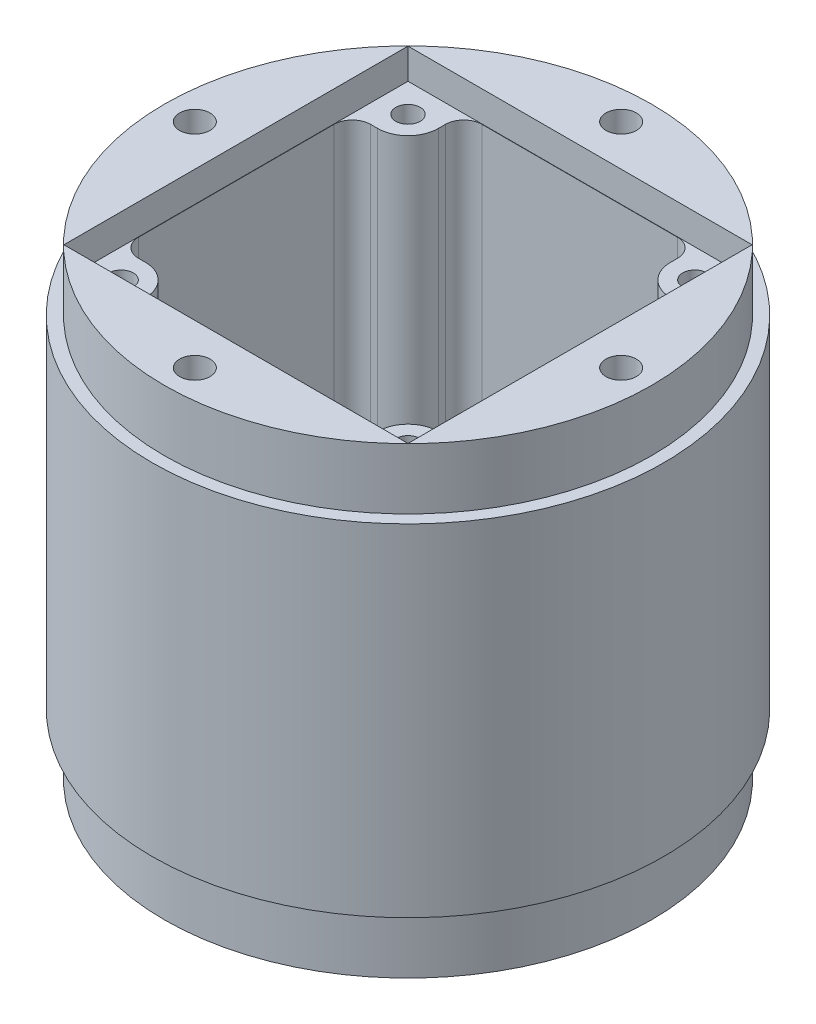
from build123d import *

# Parameters (mm, degrees)
SKETCH2_R           = 40
BOSS_EXTRUDE1_DEPTH = 76
SKETCH3_W           = 8
SKETCH3_H           = 20
CUT_EXTRUDE1_DEPTH  = 3
SKETCH4_R           = 42
SKETCH4_R_2         = 40
BOSS_EXTRUDE3_DEPTH = 28
SKETCH5_W           = 56.5
SKETCH5_H           = 56.5
CUT_EXTRUDE7_DEPTH  = 5
SKETCH6_R           = 2
CUT_EXTRUDE8_DEPTH  = 93.568893263
SKETCH7_R           = 2.5
CUT_EXTRUDE9_DEPTH  = 97.457244414


with BuildPart() as part:
    # Sketch2 → Boss-Extrude1 (new body)
    with BuildSketch(Plane(origin=(0, 0, 0), x_dir=(1, 0, 0), z_dir=(0, 1, 0))):
        Circle(SKETCH2_R)
        with BuildLine():
            Line((-16.05, 28.2), (16.05, 28.2))
            ThreePointArc((16.05, 28.2), (18.171320344, 27.321320344), (19.05, 25.2))
            Line((19.05, 25.2), (19.05, 24.05))
            ThreePointArc((19.05, 24.05), (20.514466094, 20.514466094), (24.05, 19.05))
            Line((24.05, 19.05), (25.2, 19.05))
            ThreePointArc((25.2, 19.05), (27.321320344, 18.171320344), (28.2, 16.05))
            Line((28.2, 16.05), (28.2, -16.05))
            ThreePointArc((28.2, -16.05), (27.321320344, -18.171320344), (25.2, -19.05))
            Line((25.2, -19.05), (24.05, -19.05))
            ThreePointArc((24.05, -19.05), (20.514466094, -20.514466094), (19.05, -24.05))
            Line((19.05, -24.05), (19.05, -25.2))
            ThreePointArc((19.05, -25.2), (18.171320344, -27.321320344), (16.05, -28.2))
            Line((16.05, -28.2), (-16.05, -28.2))
            ThreePointArc((-16.05, -28.2), (-18.171320344, -27.321320344), (-19.05, -25.2))
            Line((-19.05, -25.2), (-19.05, -24.05))
            ThreePointArc((-19.05, -24.05), (-20.514466094, -20.514466094), (-24.05, -19.05))
            Line((-24.05, -19.05), (-25.2, -19.05))
            ThreePointArc((-25.2, -19.05), (-27.321320344, -18.171320344), (-28.2, -16.05))
            Line((-28.2, -16.05), (-28.2, 16.05))
            ThreePointArc((-28.2, 16.05), (-27.321320344, 18.171320344), (-25.2, 19.05))
            Line((-25.2, 19.05), (-24.05, 19.05))
            ThreePointArc((-24.05, 19.05), (-20.514466094, 20.514466094), (-19.05, 24.05))
            Line((-19.05, 24.05), (-19.05, 25.2))
            ThreePointArc((-19.05, 25.2), (-18.171320344, 27.321320344), (-16.05, 28.2))
        make_face(mode=Mode.SUBTRACT)
    extrude(amount=BOSS_EXTRUDE1_DEPTH)

    # Sketch3 → Cut-Extrude1 (cut)
    with BuildSketch(Plane(origin=(0, 0, 28.2), x_dir=(-1, 0, 0), z_dir=(0, 0, -1))):
        with Locations((0, 10)):
            Rectangle(SKETCH3_W, SKETCH3_H)
    extrude(amount=-CUT_EXTRUDE1_DEPTH, mode=Mode.SUBTRACT)

    # Sketch4 → Boss-Extrude3 (add, symmetric)
    with BuildSketch(Plane(origin=(0, 38, 0), x_dir=(1, 0, 0), z_dir=(0, 1, 0))):
        Circle(SKETCH4_R)
        Circle(SKETCH4_R_2, mode=Mode.SUBTRACT)
    extrude(amount=BOSS_EXTRUDE3_DEPTH, both=True)

    # Sketch5 → Cut-Extrude7 (cut)
    with BuildSketch(Plane(origin=(0, 76, 0), x_dir=(1, 0, 0), z_dir=(0, 1, 0))):
        Rectangle(SKETCH5_W, SKETCH5_H)
    extrude(amount=-CUT_EXTRUDE7_DEPTH, mode=Mode.SUBTRACT)

    # Sketch6 → Cut-Extrude8 (cut, through all)
    with BuildSketch(Plane(origin=(0, 71, 0), x_dir=(1, 0, 0), z_dir=(0, 1, 0))):
        with Locations((-23.55, 23.55)):
            Circle(SKETCH6_R)
        with Locations((23.55, 23.55)):
            Circle(SKETCH6_R)
        with Locations((23.55, -23.55)):
            Circle(SKETCH6_R)
        with Locations((-23.55, -23.55)):
            Circle(SKETCH6_R)
    extrude(amount=-CUT_EXTRUDE8_DEPTH, mode=Mode.SUBTRACT)

    # Sketch7 → Cut-Extrude9 (cut, through all)
    with BuildSketch(Plane(origin=(0, 76, 0), x_dir=(1, 0, 0), z_dir=(0, 1, 0))):
        with Locations((0, 35)):
            Circle(SKETCH7_R)
        with Locations((35, 0)):
            Circle(SKETCH7_R)
        with Locations((0, -35)):
            Circle(SKETCH7_R)
        with Locations((-35, 0)):
            Circle(SKETCH7_R)
    extrude(amount=-CUT_EXTRUDE9_DEPTH, mode=Mode.SUBTRACT)


solid = part.part
